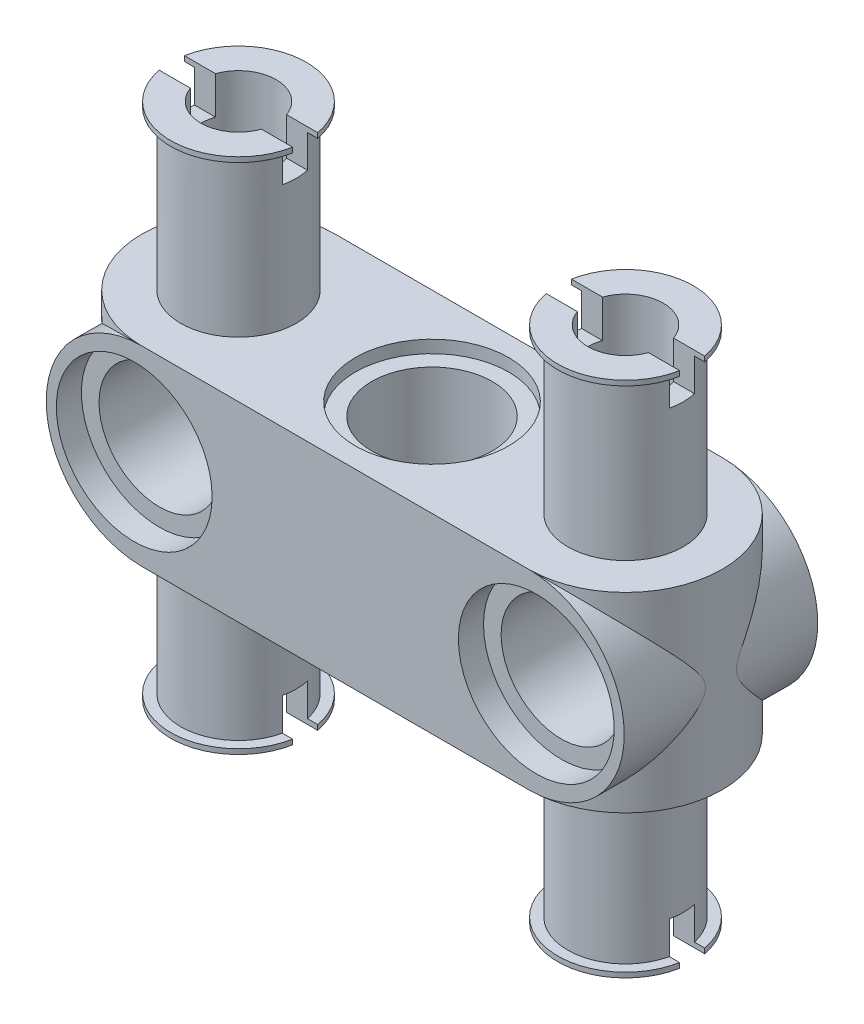
from build123d import *

# Parameters (mm, degrees)
SKETCH2_R           = 2.4
BOSS_EXTRUDE1_DEPTH = 7.7
SKETCH4_R           = 2.4
CUT_EXTRUDE1_DEPTH  = 7.7
SKETCH7_R           = 3.05
SKETCH7_R_2         = 2.4
CUT_EXTRUDE2_DEPTH  = 0.5
SKETCH8_R           = 2.3
BOSS_EXTRUDE2_DEPTH = 6.5
SKETCH9_R           = 1.5
CUT_EXTRUDE3_DEPTH  = 6.5
BOSS_EXTRUDE4_START = -3.85
SKETCH10_R          = 3.05
BOSS_EXTRUDE4_DEPTH = 3.85
SKETCH13_R          = 2.7
SKETCH13_R_2        = 2.3
BOSS_EXTRUDE6_DEPTH = 0.2
CUT_EXTRUDE4_START  = -0.5
SKETCH14_R          = 3.1
SKETCH14_R_2        = 2.4
CUT_EXTRUDE4_DEPTH  = 0.5
SKETCH16_W          = 27.88395247
SKETCH16_H          = 1
CUT_EXTRUDE5_DEPTH  = 1.5
MIRROR5_OUTLINE_R   = 3.1
MIRROR5_DEPTH       = 0.5
MIRROR5_START       = 6.7
MIRROR5_2_OUTLINE_R = 3.1
MIRROR5_2_DEPTH     = 0.5
SKETCH17_R          = 2.4
CUT_EXTRUDE6_DEPTH  = 18.285326258


# Read off the part's stored shape, not the designer's step: Mirror5
with BuildPart() as part:
    # Sketch2 → Boss-Extrude1 (new body)
    with BuildSketch(Plane.XY):
        with BuildLine():
            Line((7.7, -3.8), (-7.7, -3.8))
            ThreePointArc((-7.7, -3.8), (-11.5, 0), (-7.7, 3.8))
            Line((-7.7, 3.8), (7.7, 3.8))
            ThreePointArc((7.7, 3.8), (11.5, 0), (7.7, -3.8))
        make_face()
        with Locations(Location((8, 0, 0), (0, 0, 180))):
            Circle(SKETCH2_R, mode=Mode.SUBTRACT)
        with Locations(Location((-8, 0, 0), (0, 0, 180))):
            Circle(SKETCH2_R, mode=Mode.SUBTRACT)
    extrude(amount=BOSS_EXTRUDE1_DEPTH)

    # Sketch4 → Cut-Extrude1 (cut)
    with BuildSketch(Plane(origin=(0, 3.8, 0), x_dir=(1, 0, 0), z_dir=(0, 1, 0))):
        with Locations(Location((0, -3.85, 0), (0, 0, 180))):
            Circle(SKETCH4_R)
    extrude(amount=-CUT_EXTRUDE1_DEPTH, mode=Mode.SUBTRACT)

    # Sketch7 → Cut-Extrude2 (cut)
    with BuildSketch(Plane(origin=(0, 3.8, 0), x_dir=(1, 0, 0), z_dir=(0, 1, 0))):
        with Locations(Location((0, -3.85, 0), (0, 0, 180))):
            Circle(SKETCH7_R)
        with Locations(Location((0, -3.85, 0), (0, 0, 180))):
            Circle(SKETCH7_R_2, mode=Mode.SUBTRACT)
    cut_extrude2 = extrude(amount=-CUT_EXTRUDE2_DEPTH, mode=Mode.SUBTRACT)

    # Mirror1: Cut-Extrude2 across plane
    add(cut_extrude2.mirror(Plane.ZX), mode=Mode.SUBTRACT)

    # Sketch8 → Boss-Extrude2 (add)
    with BuildSketch(Plane(origin=(0, 3.8, 0), x_dir=(1, 0, 0), z_dir=(0, 1, 0))):
        with Locations(Location((7.7, -3.85, 0), (0, 0, 270))):
            Circle(SKETCH8_R)
        with Locations((-7.7, -3.85)):
            Circle(SKETCH8_R)
    boss_extrude2 = extrude(amount=BOSS_EXTRUDE2_DEPTH)

    # Sketch9 → Cut-Extrude3 (cut)
    with BuildSketch(Plane(origin=(0, 10.3, 0), x_dir=(1, 0, 0), z_dir=(0, 1, 0))):
        with Locations(Location((7.7, -3.85, 0), (0, 0, 180))):
            Circle(SKETCH9_R)
        with Locations(Location((-7.7, -3.85, 0), (0, 0, 180))):
            Circle(SKETCH9_R)
    cut_extrude3 = extrude(amount=-CUT_EXTRUDE3_DEPTH, mode=Mode.SUBTRACT)

    # Sketch10 → Boss-Extrude4 (add)
    # profile 1 of 3: a face of its own
    with BuildSketch(Plane(origin=(0, 3.8, 0), x_dir=(1, 0, 0), z_dir=(0, 1, 0)).offset(BOSS_EXTRUDE4_START)):
        with BuildLine():
            ThreePointArc((-7.7, 0), (-11.55, -3.85), (-7.7, -7.7))
            Line((-7.7, -7.7), (-7.7, -6.15))
            ThreePointArc((-7.7, -6.15), (-5.4, -3.85), (-7.7, -1.55))
            Line((-7.7, -1.55), (-7.7, 0))
        make_face()
    # profile 2 of 3: a face of its own
    with BuildSketch(Plane(origin=(0, 3.8, 0), x_dir=(1, 0, 0), z_dir=(0, 1, 0)).offset(BOSS_EXTRUDE4_START)):
        with BuildLine():
            Line((7.7, -7.7), (7.7, -6.15))
            ThreePointArc((7.7, -6.15), (5.4, -3.85), (7.7, -1.55))
            Line((7.7, -1.55), (7.7, 0))
            Line((7.7, 0), (-7.7, 0))
            Line((-7.7, 0), (-7.7, -1.55))
            ThreePointArc((-7.7, -1.55), (-5.4, -3.85), (-7.7, -6.15))
            Line((-7.7, -6.15), (-7.7, -7.7))
            Line((-7.7, -7.7), (7.7, -7.7))
        make_face()
        with Locations(Location((0, -3.85, 0), (0, 0, 180))):
            Circle(SKETCH10_R, mode=Mode.SUBTRACT)
    # profile 3 of 3: a face of its own
    with BuildSketch(Plane(origin=(0, 3.8, 0), x_dir=(1, 0, 0), z_dir=(0, 1, 0)).offset(BOSS_EXTRUDE4_START)):
        with BuildLine():
            ThreePointArc((7.7, 0), (11.55, -3.85), (7.7, -7.7))
            Line((7.7, -7.7), (7.7, -6.15))
            ThreePointArc((7.7, -6.15), (5.4, -3.85), (7.7, -1.55))
            Line((7.7, -1.55), (7.7, 0))
        make_face()
    boss_extrude4 = extrude(amount=BOSS_EXTRUDE4_DEPTH)

    # Mirror2: Boss-Extrude2, Cut-Extrude3, Boss-Extrude4 across plane
    add(boss_extrude2.mirror(Plane.ZX))
    add(cut_extrude3.mirror(Plane.ZX), mode=Mode.SUBTRACT)
    add(boss_extrude4.mirror(Plane.ZX))

    # Sketch13 → Boss-Extrude6 (add)
    # profile 1 of 2: a face of its own
    with BuildSketch(Plane(origin=(0, 10.1, 0), x_dir=(1, 0, 0), z_dir=(0, 1, 0))):
        with Locations(Location((-7.7, -3.85, 0), (0, 0, 180))):
            Circle(SKETCH13_R)
        with Locations((-7.7, -3.85)):
            Circle(SKETCH13_R_2, mode=Mode.SUBTRACT)
    # profile 2 of 2: a face of its own
    with BuildSketch(Plane(origin=(0, 10.1, 0), x_dir=(1, 0, 0), z_dir=(0, 1, 0))):
        with Locations(Location((7.7, -3.85, 0), (0, 0, 180))):
            Circle(SKETCH13_R)
        with Locations((7.7, -3.85)):
            Circle(SKETCH13_R_2, mode=Mode.SUBTRACT)
    boss_extrude6 = extrude(amount=BOSS_EXTRUDE6_DEPTH)

    # Sketch14 → Cut-Extrude4 (cut)
    # profile 1 of 2: a face of its own
    with BuildSketch(Plane.XY.offset(7.7).offset(CUT_EXTRUDE4_START)):
        with Locations((-8, 0)):
            Circle(SKETCH14_R)
        with Locations((-8, 0)):
            Circle(SKETCH14_R_2, mode=Mode.SUBTRACT)
    # profile 2 of 2: a face of its own
    with BuildSketch(Plane.XY.offset(7.7).offset(CUT_EXTRUDE4_START)):
        with Locations(Location((8, 0, 0), (0, 0, 180))):
            Circle(SKETCH14_R)
        with Locations((8, 0)):
            Circle(SKETCH14_R_2, mode=Mode.SUBTRACT)
    extrude(amount=CUT_EXTRUDE4_DEPTH, mode=Mode.SUBTRACT)

    # Mirror3: Boss-Extrude6 across plane
    add(boss_extrude6.mirror(Plane.ZX))

    # Sketch16 → Cut-Extrude5 (cut)
    with BuildSketch(Plane(origin=(0, 10.3, 0), x_dir=(1, 0, 0), z_dir=(0, 1, 0))):
        with Locations((0, -3.85)):
            Rectangle(SKETCH16_W, SKETCH16_H)
    cut_extrude5 = extrude(amount=-CUT_EXTRUDE5_DEPTH, mode=Mode.SUBTRACT)

    # Mirror4: Cut-Extrude5 across plane
    add(cut_extrude5.mirror(Plane.ZX), mode=Mode.SUBTRACT)

    # Mirror5 outline → Mirror5 (cut)
    # profile 1 of 2: a face of its own
    with BuildSketch(Plane.XY):
        with Locations((-8, 0)):
            Circle(MIRROR5_OUTLINE_R)
        with BuildLine():
            ThreePointArc((-10.288436326, 0.723228306), (-5.6, 7.56e-07), (-10.28843587, -0.72322975))
            ThreePointArc((-10.28843587, -0.72322975), (-10.4, -7.57e-07), (-10.288436326, 0.723228306))
        make_face(mode=Mode.SUBTRACT)
    # profile 2 of 2: a face of its own
    with BuildSketch(Plane.XY):
        with Locations((8, 0)):
            Circle(MIRROR5_OUTLINE_R)
        with BuildLine():
            ThreePointArc((10.28843587, -0.72322975), (5.6, 7.56e-07), (10.288436326, 0.723228306))
            ThreePointArc((10.288436326, 0.723228306), (10.4, -7.57e-07), (10.28843587, -0.72322975))
        make_face(mode=Mode.SUBTRACT)
    extrude(amount=MIRROR5_DEPTH, mode=Mode.SUBTRACT)

    # Mirror5 2 outline → Mirror5 2 (cut)
    # profile 1 of 2: a face of its own
    with BuildSketch(Plane.XY.offset(MIRROR5_START)):
        with Locations((-8, 0)):
            Circle(MIRROR5_2_OUTLINE_R)
        with BuildLine():
            ThreePointArc((-10.288436326, 0.723228306), (-5.6, 7.56e-07), (-10.28843587, -0.72322975))
            ThreePointArc((-10.28843587, -0.72322975), (-10.4, -7.57e-07), (-10.288436326, 0.723228306))
        make_face(mode=Mode.SUBTRACT)
    # profile 2 of 2: a face of its own
    with BuildSketch(Plane.XY.offset(MIRROR5_START)):
        with Locations((8, 0)):
            Circle(MIRROR5_2_OUTLINE_R)
        with BuildLine():
            ThreePointArc((10.28843587, -0.72322975), (5.6, 7.56e-07), (10.288436326, 0.723228306))
            ThreePointArc((10.288436326, 0.723228306), (10.4, -7.57e-07), (10.28843587, -0.72322975))
        make_face(mode=Mode.SUBTRACT)
    extrude(amount=MIRROR5_2_DEPTH, mode=Mode.SUBTRACT)

    # Sketch17 → Cut-Extrude6 (cut, through all)
    with BuildSketch(Plane(origin=(0, 0, 0), x_dir=(-1, 0, 0), z_dir=(0, 0, -1))):
        with Locations((-8, 0)):
            Circle(SKETCH17_R)
        with Locations((8, 0)):
            Circle(SKETCH17_R)
    extrude(amount=-CUT_EXTRUDE6_DEPTH, mode=Mode.SUBTRACT)


solid = part.part
